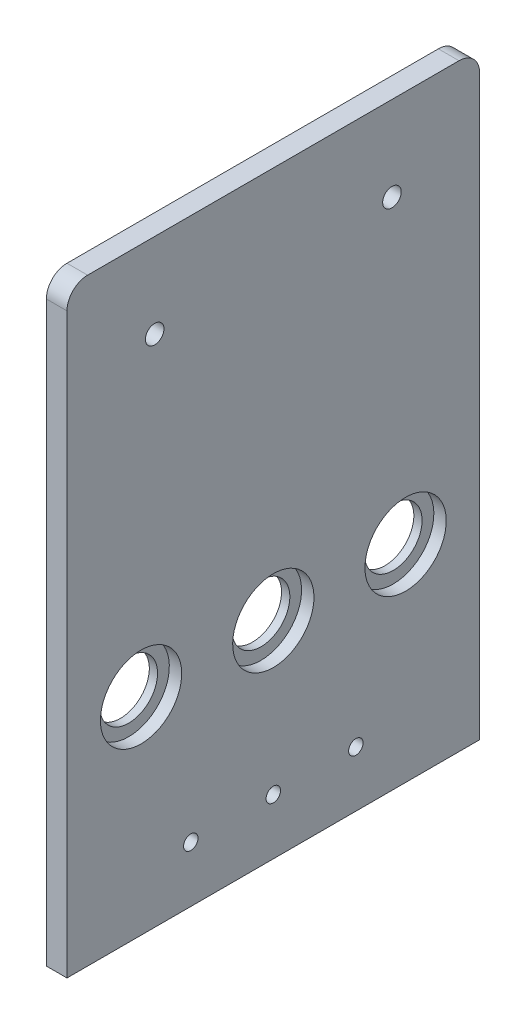
from build123d import *

# Parameters (mm, degrees)
BOSS_EXTRUDE1_DEPTH            = 100
CUT_EXTRUDE3_DEPTH             = 202.556443707
CUT_EXTRUDE3_DEPTH_BACK        = 202.556443707
SKETCH4_4_R                    = 9.85
CUT_EXTRUDE4_DEPTH             = 3
CUT_EXTRUDE5_START             = 103
SKETCH4_6_R                    = 9.85
CUT_EXTRUDE5_DEPTH             = 103
CUT_EXTRUDE6_REACH             = 206.206
SKETCH5_R                      = 2.25
CUT_EXTRUDE6_DIRECTION_2_DEPTH = 205.205778567
CUT_EXTRUDE7_REACH             = 201.841
SKETCH6_R                      = 2.25
SKETCH7_W                      = 12
SKETCH7_H                      = 15
CUT_EXTRUDE8_DEPTH             = 197.242821038
FILLET3_R                      = 2.5
FILLET4_R                      = 2.5
FILLET6_R                      = 5
CUT_EXTRUDE11_REACH            = 198.243
SKETCH8_W                      = 41.5
SKETCH8_H                      = 5
CUT_EXTRUDE12_REACH            = 174.119
SKETCH9_R                      = 1.75


with BuildPart() as part:
    # Sketch1 → Boss-Extrude1 (new body)
    with BuildSketch(Plane.XY):
        Polygon((-10.600610125, 140), (-15.600610125, 140), (-15.600610125, -5), (94.399389875, -5), (94.399389875, 140), (89.399389875, 140), (89.399389875, 0), (-10.600610125, 0), align=None)
    extrude(amount=-BOSS_EXTRUDE1_DEPTH)

    # Sketch4 → Cut-Extrude3 (cut, two sides: drawn at the far end of the back side and taken through both)
    with BuildSketch(Plane.ZY.offset(-89.399389875).offset(-CUT_EXTRUDE3_DEPTH_BACK)):
        with BuildLine():
            ThreePointArc((-89.05, 45), (-82.05, 38), (-75.05, 45))
            Line((-75.05, 45), (-82.05, 45))
            Line((-82.05, 45), (-89.05, 45))
        make_face()
        with BuildLine():
            Line((-82.05, 45), (-75.05, 45))
            ThreePointArc((-75.05, 45), (-82.05, 52), (-89.05, 45))
            Line((-89.05, 45), (-82.05, 45))
        make_face()
        with BuildLine():
            ThreePointArc((-57, 45), (-50, 38), (-43, 45))
            Line((-43, 45), (-50, 45))
            Line((-50, 45), (-57, 45))
        make_face()
        with BuildLine():
            Line((-50, 45), (-43, 45))
            ThreePointArc((-43, 45), (-50, 52), (-57, 45))
            Line((-57, 45), (-50, 45))
        make_face()
        with BuildLine():
            ThreePointArc((-24.95, 45), (-17.95, 38), (-10.95, 45))
            Line((-10.95, 45), (-17.95, 45))
            Line((-17.95, 45), (-24.95, 45))
        make_face()
        with BuildLine():
            Line((-17.95, 45), (-10.95, 45))
            ThreePointArc((-10.95, 45), (-17.95, 52), (-24.95, 45))
            Line((-24.95, 45), (-17.95, 45))
        make_face()
    extrude(amount=CUT_EXTRUDE3_DEPTH + CUT_EXTRUDE3_DEPTH_BACK, mode=Mode.SUBTRACT)

    # Sketch4<4> → Cut-Extrude4 (cut)
    with BuildSketch(Plane.ZY.offset(-89.399389875)):
        with Locations((-50, 45)):
            Circle(SKETCH4_4_R)
        with Locations((-82.05, 45)):
            Circle(SKETCH4_4_R)
        with Locations((-17.95, 45)):
            Circle(SKETCH4_4_R)
    extrude(amount=-CUT_EXTRUDE4_DEPTH, mode=Mode.SUBTRACT)

    # Sketch4<6> → Cut-Extrude5 (cut)
    with BuildSketch(Plane.ZY.offset(-89.399389875).offset(CUT_EXTRUDE5_START)):
        with Locations((-50, 45)):
            Circle(SKETCH4_6_R)
        with Locations((-82.05, 45)):
            Circle(SKETCH4_6_R)
        with Locations((-17.95, 45)):
            Circle(SKETCH4_6_R)
    extrude(amount=-CUT_EXTRUDE5_DEPTH, mode=Mode.SUBTRACT)

    # Sketch5 → Cut-Extrude6 (cut, up to next)
    with BuildSketch(Plane.ZY.offset(15.600610125), mode=Mode.PRIVATE) as cut_extrude6_sk1:
        with Locations(Location((-78.75, 119.5, 0), (0, 0, 90))):
            Circle(SKETCH5_R)
    cut_extrude6_tool1 = extrude(cut_extrude6_sk1.sketch, amount=-CUT_EXTRUDE6_REACH, mode=Mode.PRIVATE) & part.part
    # Sketch5 → Cut-Extrude6 (cut, up to next)
    with BuildSketch(Plane.ZY.offset(15.600610125), mode=Mode.PRIVATE) as cut_extrude6_sk2:
        with Locations(Location((-21.25, 119.5, 0), (0, 0, 90))):
            Circle(SKETCH5_R)
    cut_extrude6_tool2 = extrude(cut_extrude6_sk2.sketch, amount=-CUT_EXTRUDE6_REACH, mode=Mode.PRIVATE) & part.part
    add(cut_extrude6_tool1.solids().sort_by_distance((-15.60061, 119.5, -78.75))[0], mode=Mode.SUBTRACT)
    add(cut_extrude6_tool2.solids().sort_by_distance((-15.60061, 119.5, -21.25))[0], mode=Mode.SUBTRACT)

    # Sketch5 → Cut-Extrude6 direction 2 (cut)
    with BuildSketch(Plane.ZY.offset(15.600610125)):
        with Locations(Location((-78.75, 119.5, 0), (0, 0, 90))):
            Circle(SKETCH5_R)
        with Locations(Location((-21.25, 119.5, 0), (0, 0, 90))):
            Circle(SKETCH5_R)
    extrude(amount=CUT_EXTRUDE6_DIRECTION_2_DEPTH, mode=Mode.SUBTRACT)

    # Sketch6 → Cut-Extrude7 (cut, up to next)
    with BuildSketch(Plane.XZ.offset(5), mode=Mode.PRIVATE) as cut_extrude7_sk1:
        with Locations(Location((71.899389875, -50, 0), (0, 0, 270))):
            Circle(SKETCH6_R)
    cut_extrude7_tool1 = extrude(cut_extrude7_sk1.sketch, amount=-CUT_EXTRUDE7_REACH, mode=Mode.PRIVATE) & part.part
    # Sketch6 → Cut-Extrude7 (cut, up to next)
    with BuildSketch(Plane.XZ.offset(5), mode=Mode.PRIVATE) as cut_extrude7_sk2:
        with Locations(Location((6.899389875, -50, 0), (0, 0, 270))):
            Circle(SKETCH6_R)
    cut_extrude7_tool2 = extrude(cut_extrude7_sk2.sketch, amount=-CUT_EXTRUDE7_REACH, mode=Mode.PRIVATE) & part.part
    add(cut_extrude7_tool1.solids().sort_by_distance((71.89939, -5, -50))[0], mode=Mode.SUBTRACT)
    add(cut_extrude7_tool2.solids().sort_by_distance((6.89939, -5, -50))[0], mode=Mode.SUBTRACT)

    # Sketch7 → Cut-Extrude8 (cut, through all)
    with BuildSketch(Plane(origin=(0, 0, 0), x_dir=(1, 0, 0), z_dir=(0, 1, 0))):
        Polygon((45.399389875, 100), (39.399389875, 100), (33.399389875, 100), (33.399389875, 85), (45.399389875, 85), align=None)
        with Locations((39.399389875, 7.5)):
            Rectangle(SKETCH7_W, SKETCH7_H)
    extrude(amount=-CUT_EXTRUDE8_DEPTH, mode=Mode.SUBTRACT)

    # Fillet3
    fillet3_edges = [part.edges().sort_by_distance(p)[0] for p in [
        (33.399389875, 0, -7.5),
        (33.399389875, -2.5, 0),
        (39.399389875, 0, -15),
        (33.399389875, -2.5, -15),
        (45.399389875, -5, -7.5),
        (45.399389875, -2.5, -15),
        (45.399389875, -2.5, 0),
        (33.399389875, -5, -7.5),
        (39.399389875, -5, -15),
        (45.399389875, 0, -7.5),
    ]]
    fillet(fillet3_edges, radius=FILLET3_R - 0.0001)  # a hair under: the kernel refuses the full size

    # Fillet4
    fillet4_edges = [part.edges().sort_by_distance(p)[0] for p in [
        (45.399389875, 0, -92.5),
        (45.399389875, -2.5, -100),
        (39.399389875, -5, -85),
        (45.399389875, -2.5, -85),
        (33.399389875, -5, -92.5),
        (33.399389875, -2.5, -85),
        (33.399389875, -2.5, -100),
        (45.399389875, -5, -92.5),
        (33.399389875, 0, -92.5),
        (39.399389875, 0, -85),
    ]]
    fillet(fillet4_edges, radius=FILLET4_R - 0.0001)  # a hair under: the kernel refuses the full size

    # Fillet6
    fillet6_edges = [part.edges().sort_by_distance(p)[0] for p in [
        (91.899389875, 140, -100),
        (-13.100610125, 140, -100),
        (-13.100610125, 140, 0),
        (91.899389875, 140, 0),
    ]]
    fillet(fillet6_edges, radius=FILLET6_R)

    # Sketch8 → Cut-Extrude11 (cut, up to next)
    with BuildSketch(Plane.XY, mode=Mode.PRIVATE) as cut_extrude11_sk1:
        with Locations((10.149389875, -2.5)):
            Rectangle(SKETCH8_W, SKETCH8_H)
    cut_extrude11_tool1 = extrude(cut_extrude11_sk1.sketch, amount=-CUT_EXTRUDE11_REACH, mode=Mode.PRIVATE) & part.part
    # Sketch8 → Cut-Extrude11 (cut, up to next)
    with BuildSketch(Plane.XY, mode=Mode.PRIVATE) as cut_extrude11_sk2:
        Polygon((-10.600610125, 135), (-10.600610125, 0), (30.899389875, 0), (30.899389875, -5), (94.399389875, -5), (94.399389875, 140), (-10.600610125, 140), align=None)
    cut_extrude11_tool2 = extrude(cut_extrude11_sk2.sketch, amount=-CUT_EXTRUDE11_REACH, mode=Mode.PRIVATE) & part.part
    add(cut_extrude11_tool1.solids().sort_by_distance((10.14939, -2.5, 0))[0], mode=Mode.SUBTRACT)
    add(cut_extrude11_tool2.solids().sort_by_distance((42.338086, 68.467205, 0))[0], mode=Mode.SUBTRACT)

    # Sketch9 → Cut-Extrude12 (cut, up to next)
    with BuildSketch(Plane(origin=(-10.600610125, 0, 0), x_dir=(0, 0, -1), z_dir=(1, 0, 0)), mode=Mode.PRIVATE) as cut_extrude12_sk1:
        with Locations(Location((70, 8.5, 0), (0, 0, 90))):
            Circle(SKETCH9_R)
    cut_extrude12_tool1 = extrude(cut_extrude12_sk1.sketch, amount=-CUT_EXTRUDE12_REACH, mode=Mode.PRIVATE) & part.part
    # Sketch9 → Cut-Extrude12 (cut, up to next)
    with BuildSketch(Plane(origin=(-10.600610125, 0, 0), x_dir=(0, 0, -1), z_dir=(1, 0, 0)), mode=Mode.PRIVATE) as cut_extrude12_sk2:
        with Locations(Location((50, 8.5, 0), (0, 0, 90))):
            Circle(SKETCH9_R)
    cut_extrude12_tool2 = extrude(cut_extrude12_sk2.sketch, amount=-CUT_EXTRUDE12_REACH, mode=Mode.PRIVATE) & part.part
    # Sketch9 → Cut-Extrude12 (cut, up to next)
    with BuildSketch(Plane(origin=(-10.600610125, 0, 0), x_dir=(0, 0, -1), z_dir=(1, 0, 0)), mode=Mode.PRIVATE) as cut_extrude12_sk3:
        with Locations(Location((30, 8.5, 0), (0, 0, 90))):
            Circle(SKETCH9_R)
    cut_extrude12_tool3 = extrude(cut_extrude12_sk3.sketch, amount=-CUT_EXTRUDE12_REACH, mode=Mode.PRIVATE) & part.part
    add(cut_extrude12_tool1.solids().sort_by_distance((-10.60061, 8.5, -70))[0], mode=Mode.SUBTRACT)
    add(cut_extrude12_tool2.solids().sort_by_distance((-10.60061, 8.5, -50))[0], mode=Mode.SUBTRACT)
    add(cut_extrude12_tool3.solids().sort_by_distance((-10.60061, 8.5, -30))[0], mode=Mode.SUBTRACT)


solid = part.part
